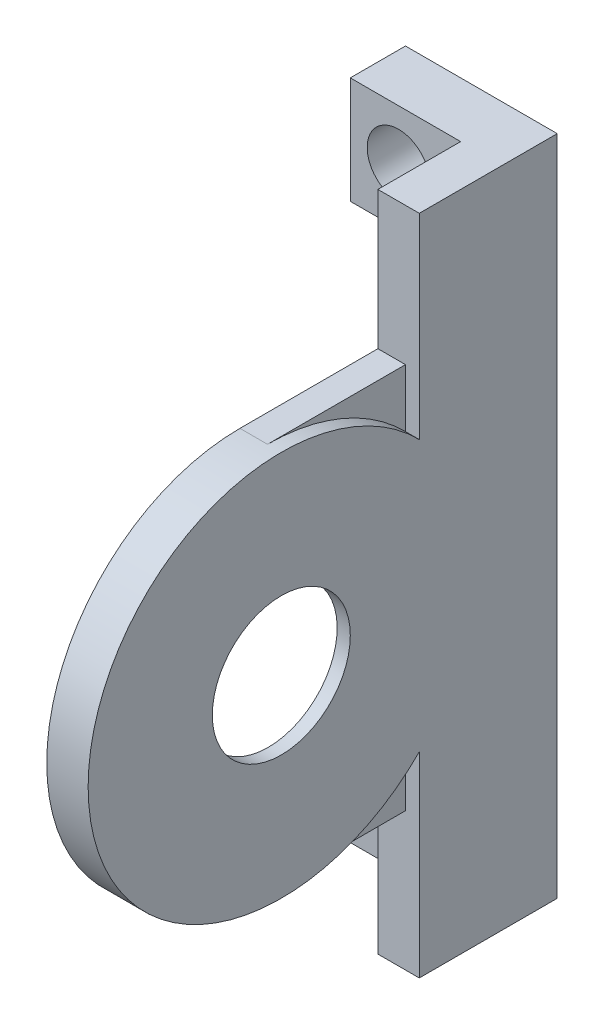
from build123d import *

# Parameters (mm, degrees)
SKETCH_1_W          = 20
SKETCH_1_H          = 56
EXTRUDE_1_DEPTH     = 8
SKETCH_2_W          = 4
SKETCH_2_H          = 56
EXTRUDE_2_DEPTH     = 60
FILLET_1_R          = 28
SKETCH_5_R          = 28
EXTRUDE_3_DEPTH     = 2
CUT_EXTRUDE_2_DEPTH = 4.1
SKETCH_6_W          = 20
SKETCH_6_H          = 56
EXTRUDE_4_DEPTH     = 2
SKETCH_7_R          = 10
CUT_EXTRUDE_3_DEPTH = 2
EXTRUDE_5_DEPTH     = 20
SKETCH_3_R          = 4.55
CUT_EXTRUDE_1_DEPTH = 60
SKETCH_9_W          = 15
SKETCH_9_H          = 65
CUT_EXTRUDE_4_DEPTH = 78.768888381


with BuildPart() as part:
    # 스케치1 → 보스-돌출1 (new body)
    with BuildSketch(Plane.XY):
        Rectangle(SKETCH_1_W, SKETCH_1_H)
    extrude(amount=EXTRUDE_1_DEPTH)

    # 스케치2 → 보스-돌출2 (add)
    with BuildSketch(Plane.XY.offset(8)):
        with Locations((8, 0)):
            Rectangle(SKETCH_2_W, SKETCH_2_H)
    extrude(amount=EXTRUDE_2_DEPTH)

    # 필렛1
    fillet_1_edges = [part.edges().sort_by_distance(p)[0] for p in [
        (8, 28, 68),
        (8, -28, 68),
    ]]
    fillet(fillet_1_edges, radius=FILLET_1_R - 0.0001)  # a hair under: the kernel refuses the full size

    # 스케치5 → 보스-돌출3 (add)
    with BuildSketch(Plane(origin=(10, 0, 0), x_dir=(0, 0, -1), z_dir=(1, 0, 0))):
        with Locations(Location((-40, 0, 0), (0, 0, 90))):
            Circle(SKETCH_5_R)
    extrude(amount=EXTRUDE_3_DEPTH)

    # 스케치4 → 컷-돌출2 (cut)
    with BuildSketch(Plane.ZY.offset(-6)):
        with BuildLine():
            Line((35, 16), (35, 19.364916731))
            ThreePointArc((35, 19.364916731), (20, 0), (35, -19.364916731))
            Line((35, -19.364916731), (35, -16))
            Line((35, -16), (45, -16))
            Line((45, -16), (45, -19.364916731))
            ThreePointArc((45, -19.364916731), (55.811388301, -12.247448714), (60, 0))
            ThreePointArc((60, 0), (55.811388301, 12.247448714), (45, 19.364916731))
            Line((45, 19.364916731), (45, 16))
            Line((45, 16), (35, 16))
        make_face()
        with BuildLine():
            ThreePointArc((45, -19.364916731), (40, -20), (35, -19.364916731))
            Line((35, -19.364916731), (35, -24))
            Line((35, -24), (45, -24))
            Line((45, -24), (45, -19.364916731))
        make_face()
        with BuildLine():
            Line((35, -16), (35, -19.364916731))
            ThreePointArc((35, -19.364916731), (40, -20), (45, -19.364916731))
            Line((45, -19.364916731), (45, -16))
            Line((45, -16), (35, -16))
        make_face()
        with BuildLine():
            Line((45, 24), (35, 24))
            Line((35, 24), (35, 19.364916731))
            ThreePointArc((35, 19.364916731), (40, 20), (45, 19.364916731))
            Line((45, 19.364916731), (45, 24))
        make_face()
        with BuildLine():
            ThreePointArc((45, 19.364916731), (40, 20), (35, 19.364916731))
            Line((35, 19.364916731), (35, 16))
            Line((35, 16), (45, 16))
            Line((45, 16), (45, 19.364916731))
        make_face()
    extrude(amount=-CUT_EXTRUDE_2_DEPTH, mode=Mode.SUBTRACT)

    # 스케치6 → 보스-돌출4 (add)
    with BuildSketch(Plane(origin=(10, 0, 0), x_dir=(0, 0, -1), z_dir=(1, 0, 0))):
        with Locations((-10, 0)):
            Rectangle(SKETCH_6_W, SKETCH_6_H)
    extrude(amount=EXTRUDE_4_DEPTH)

    # 스케치7 → 컷-돌출3 (cut)
    with BuildSketch(Plane.ZY.offset(-10.1)):
        with Locations(Location((40, 0, 0), (0, 0, 270))):
            Circle(SKETCH_7_R)
    extrude(amount=-CUT_EXTRUDE_3_DEPTH, mode=Mode.SUBTRACT)

    # 스케치8 → 보스-돌출5 (add)
    with BuildSketch(Plane(origin=(0, 28, 0), x_dir=(1, 0, 0), z_dir=(0, 1, 0))):
        Polygon((-10, -8), (-10, 0), (12, 0), (12, -20), (6, -20), (6, -8), align=None)
    extrude_5 = extrude(amount=EXTRUDE_5_DEPTH)

    # 대칭 복사1: 보스-돌출5 across plane
    add(extrude_5.mirror(Plane.ZX))

    # 스케치3 → 컷-돌출1 (cut)
    with BuildSketch(Plane.XY.offset(8)):
        with Locations((-3, -40.5)):
            Circle(SKETCH_3_R)
        with Locations((-3, 40.5)):
            Circle(SKETCH_3_R)
    extrude(amount=-CUT_EXTRUDE_1_DEPTH, mode=Mode.SUBTRACT)

    # 스케치9 → 컷-돌출4 (cut, through all)
    with BuildSketch(Plane.XY.offset(8)):
        with Locations((-2.5, 0)):
            Rectangle(SKETCH_9_W, SKETCH_9_H)
    extrude(amount=-CUT_EXTRUDE_4_DEPTH, mode=Mode.SUBTRACT)


solid = part.part
